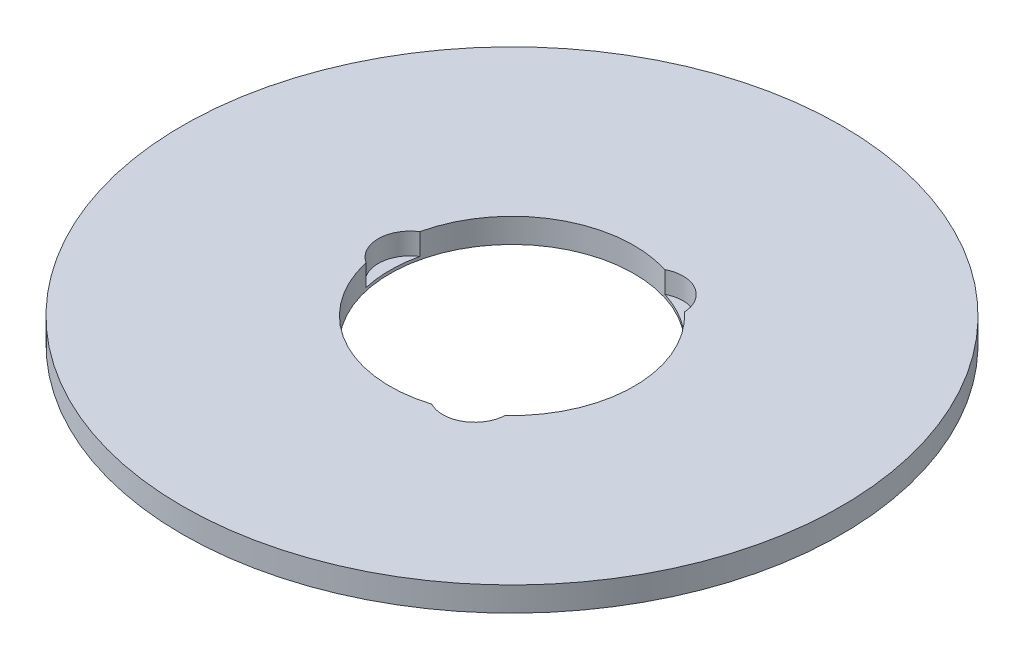
from build123d import *

# Parameters (mm, degrees)
SKETCH1_R           = 67.5
BOSS_EXTRUDE1_DEPTH = 5
SKETCH2_R           = 25
CUT_EXTRUDE1_DEPTH  = 96.590271472
SKETCH3_R           = 6.536327821
CUT_EXTRUDE2_DEPTH  = 4.400142072
CIRPATTERN1_COUNT   = 3


with BuildPart() as part:
    # Sketch1 → Boss-Extrude1 (new body)
    with BuildSketch(Plane(origin=(0, 0, 0), x_dir=(1, 0, 0), z_dir=(0, 1, 0))):
        Circle(SKETCH1_R)
    extrude(amount=BOSS_EXTRUDE1_DEPTH)

    # Sketch2 → Cut-Extrude1 (cut, through all)
    with BuildSketch(Plane(origin=(0, 0, 0), x_dir=(1, 0, 0), z_dir=(0, 1, 0))):
        Circle(SKETCH2_R)
    extrude(amount=CUT_EXTRUDE1_DEPTH, mode=Mode.SUBTRACT)

    # Sketch3 → Cut-Extrude2 (cut)
    with BuildSketch(Plane(origin=(0, 5, 0), x_dir=(1, 0, 0), z_dir=(0, 1, 0))):
        with Locations((-20.859397748, 0)):
            Circle(SKETCH3_R)
    cut_extrude2 = extrude(amount=-CUT_EXTRUDE2_DEPTH, mode=Mode.SUBTRACT)

    # CirPattern1: Cut-Extrude2 ×3 about axis
    cirpattern1_axis = Axis((0, 0, 0), (0, 1, 0))
    for i in range(1, CIRPATTERN1_COUNT):
        add(cut_extrude2.rotate(cirpattern1_axis, i * 360 / CIRPATTERN1_COUNT), mode=Mode.SUBTRACT)


solid = part.part
